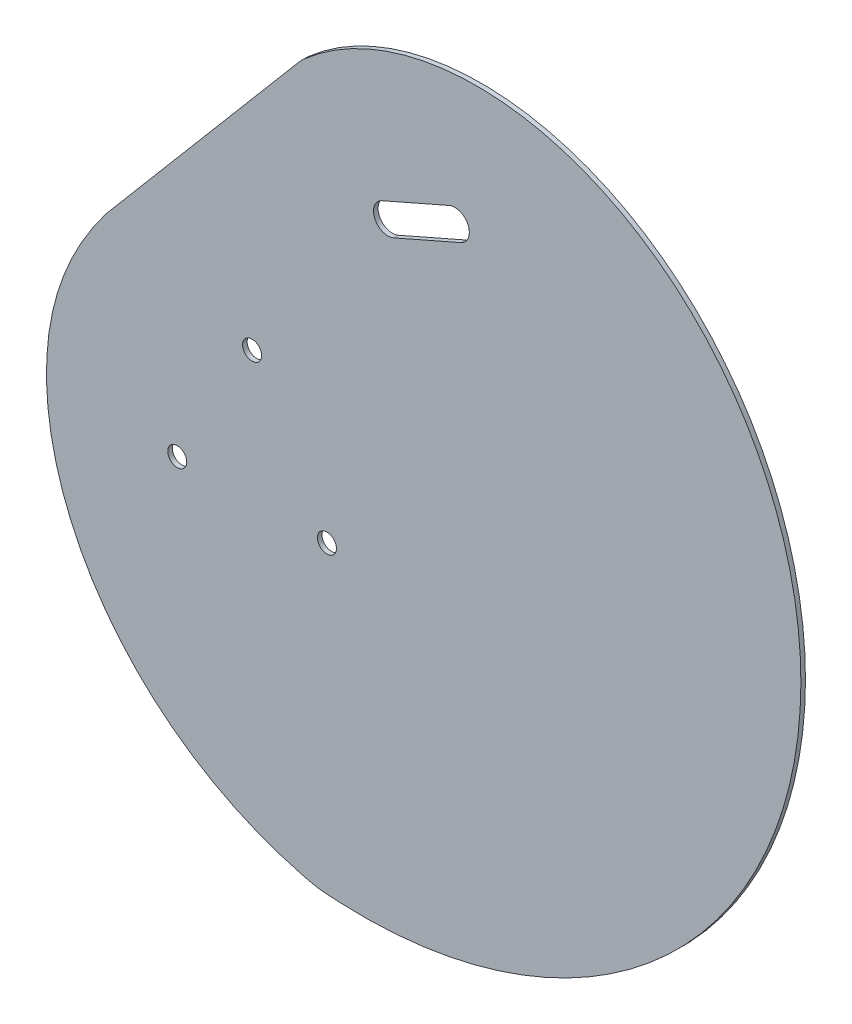
from build123d import *

# Parameters (mm, degrees)
BOSS_EXTRUDE1_START     = -0.396875
BOSS_EXTRUDE1_OUTLINE_R = 3.175
BOSS_EXTRUDE1_DEPTH     = 0.79375
CUT_EXTRUDE1_DEPTH      = 113.8252875
CUT_EXTRUDE1_DEPTH_BACK = 113.8252875
BOSS_EXTRUDE2_DEPTH     = 0.79375
M4X0_7_TAPPED_HOLE1_D   = 3.3
FILLET1_R               = 10
SKETCH7_W               = 13.91508681
SKETCH7_H               = 14.554044878
BOSS_EXTRUDE3_DEPTH     = 0.79375
CUT_EXTRUDE2_DEPTH      = 209.855679674


# Read off the part's stored shape, not the designer's step: Boss-Extrude1
with BuildPart() as part:
    # Boss-Extrude1 outline → Boss-Extrude1 (new body)
    with BuildSketch(Plane.XY.offset(BOSS_EXTRUDE1_START)):
        with BuildLine():
            add(Edge.make_bspline(
                [(-1.261284319, -76.388996664), (-0.976706936, -76.433000958), (-0.405700337, -76.500288673), (0.20528297, -76.543128655), (0.635947633, -76.565923488), (0.943803396, -76.583753699), (1.516577668, -76.625352645), (2.394728617, -76.679422652), (3.180819277, -76.713700374), (4.198037, -76.751687246), (6.052140639, -76.794272093), (8.655318967, -76.775789965), (11.799230285, -76.631186754), (14.930811608, -76.362150817), (19.092729282, -75.837698968), (24.252600304, -74.870904239), (30.336691794, -73.215166518), (38.249637718, -70.355302933), (47.664657668, -65.580710673), (57.878240574, -58.05265885), (69.647247229, -45.860449013), (80.17301629, -27.133451477), (84.253863041, -1.504791655), (79.559994743, 19.841206748), (70.879686514, 34.940163896), (62.021642873, 44.705365527), (51.090741107, 52.264081212), (38.576471747, 57.054085928), (25.100477493, 58.560382298), (13.770836895, 56.694329393), (5.225744009, 53.179291686), (-0.757485487, 49.527464518), (-5.179825642, 45.648133226), (-8.217128683, 42.311123306), (-10.283747679, 39.728556446), (-12.145398141, 37.129923022), (-13.803593656, 34.630220241), (-15.026366639, 32.787217268), (-15.757749026, 31.815043574), (-16.457283709, 31.008797547), (-17.314853043, 30.212425612), (-18.832098717, 29.140541156), (-20.579433545, 27.921014995), (-21.851448321, 26.952812158), (-22.922913486, 26.025576334), (-23.911333005, 25.095774574), (-25.043884789, 23.905717811), (-26.24444516, 22.476950142), (-27.667877154, 20.603207832), (-29.166272015, 18.381706059), (-30.682003525, 16.030489806), (-31.841745016, 14.323419156), (-32.792926522, 13.025871938), (-33.760991701, 11.771777118), (-35.193517942, 10.031827499), (-37.094774354, 7.688586111), (-39.650513176, 4.306101851), (-42.651423752, -0.366044153), (-45.535555759, -6.547251373), (-47.502970249, -13.211657775), (-48.684497464, -22.369909682), (-47.609886804, -33.732208724), (-42.864240814, -46.345132644), (-36.564129821, -55.468027352), (-30.429657579, -61.727526273), (-25.356811503, -65.867230195), (-20.797895182, -68.82985851), (-16.986888823, -70.897278381), (-14.057126153, -72.294062473), (-11.057489783, -73.537247471), (-8.528639781, -74.438248663), (-6.705355358, -75.008839512), (-5.69991862, -75.303300743), (-4.914663461, -75.525329661), (-4.043728169, -75.751750303), (-3.477018465, -75.89115289), (-3.15620306, -75.974687703), (-2.718728151, -76.089597955), (-2.113164636, -76.236262909), (-1.545861702, -76.34499237), (-1.261284319, -76.388996664)],
                knots=[0, 0, 0, 0, 0.000976562, 0.001953125, 0.002929688, 0.00390625, 0.005859375, 0.0078125, 0.009765625, 0.01171875, 0.015625, 0.0234375, 0.03125, 0.0390625, 0.046875, 0.0625, 0.078125, 0.09375, 0.125, 0.15625, 0.1875, 0.25, 0.3125, 0.375, 0.40625, 0.4375, 0.46875, 0.5, 0.53125, 0.5625, 0.578125, 0.59375, 0.609375, 0.6171875, 0.625, 0.6328125, 0.640625, 0.6484375, 0.65234375, 0.65625, 0.6640625, 0.671875, 0.67578125, 0.6796875, 0.681640625, 0.68359375, 0.6875, 0.69140625, 0.6953125, 0.703125, 0.7109375, 0.71875, 0.72265625, 0.7265625, 0.734375, 0.7421875, 0.75, 0.765625, 0.78125, 0.796875, 0.8125, 0.84375, 0.875, 0.90625, 0.921875, 0.9375, 0.953125, 0.9609375, 0.96875, 0.9765625, 0.984375, 0.98828125, 0.990234375, 0.9921875, 0.994140625, 0.99609375, 0.997070312, 0.998046875, 0.999023438, 1, 1, 1, 1], degree=3))
        make_face()
        Circle(BOSS_EXTRUDE1_OUTLINE_R, mode=Mode.SUBTRACT)
    extrude(amount=BOSS_EXTRUDE1_DEPTH)

    # Sketch2 → Cut-Extrude1 (cut, two sides: drawn at the far end of the back side and taken through both)
    with BuildSketch(Plane.XY.offset(-CUT_EXTRUDE1_DEPTH_BACK)):
        Polygon((-4.119310262, 46.506747557), (-37.979985712, 6.507923903), (-21.102439727, 46.506747557), align=None)
    extrude(amount=CUT_EXTRUDE1_DEPTH + CUT_EXTRUDE1_DEPTH_BACK, mode=Mode.SUBTRACT)

    # Sketch6 → Boss-Extrude2 (add)
    with BuildSketch(Plane.XY.offset(0.396875)):
        Polygon((-4.119310262, 46.506747557), (-18.797566669, 29.167666698), (-15.709388941, 26.553395222), (-1.031132534, 43.892476081), align=None)
    extrude(amount=-BOSS_EXTRUDE2_DEPTH)

    # M4x0.7 Tapped Hole1 (through all)
    with Locations(Plane.XY.offset(0.396875)):
        with Locations((-12.593900177, -1.272585975), (0.396480879, -23.772585975), (-25.584281234, -23.772585975)):
            Hole(M4X0_7_TAPPED_HOLE1_D / 2)

    # Fillet1
    fillet1_edges = [part.edges().sort_by_distance(p)[0] for p in [
        (-4.119310262, 46.506747557, 0),
    ]]
    fillet(fillet1_edges, radius=FILLET1_R)

    # Sketch7 → Boss-Extrude3 (add)
    with BuildSketch(Plane.XY.offset(0.396875)):
        with Locations((0.167886722, 0.454424986)):
            Rectangle(SKETCH7_W, SKETCH7_H)
    extrude(amount=-BOSS_EXTRUDE3_DEPTH)

    # Sketch9 → Cut-Extrude2 (cut, through all)
    with BuildSketch(Plane(origin=(-36.243419388, 94.915618056, -0.396875), x_dir=(-0.35672656878331593, 0.9342088391382743, 0), z_dir=(0, 0, 1))):
        with BuildLine():
            Line((-79.814896425, -21.147562089), (-79.196769607, -33.83251062))
            ThreePointArc((-79.196769607, -33.83251062), (-76.578053987, -36.207869225), (-74.202695382, -33.589153605))
            Line((-74.202695382, -33.589153605), (-74.8208222, -20.904205074))
            ThreePointArc((-74.8208222, -20.904205074), (-77.43953782, -18.528846469), (-79.814896425, -21.147562089))
        make_face()
    extrude(amount=CUT_EXTRUDE2_DEPTH, mode=Mode.SUBTRACT)


solid = part.part
